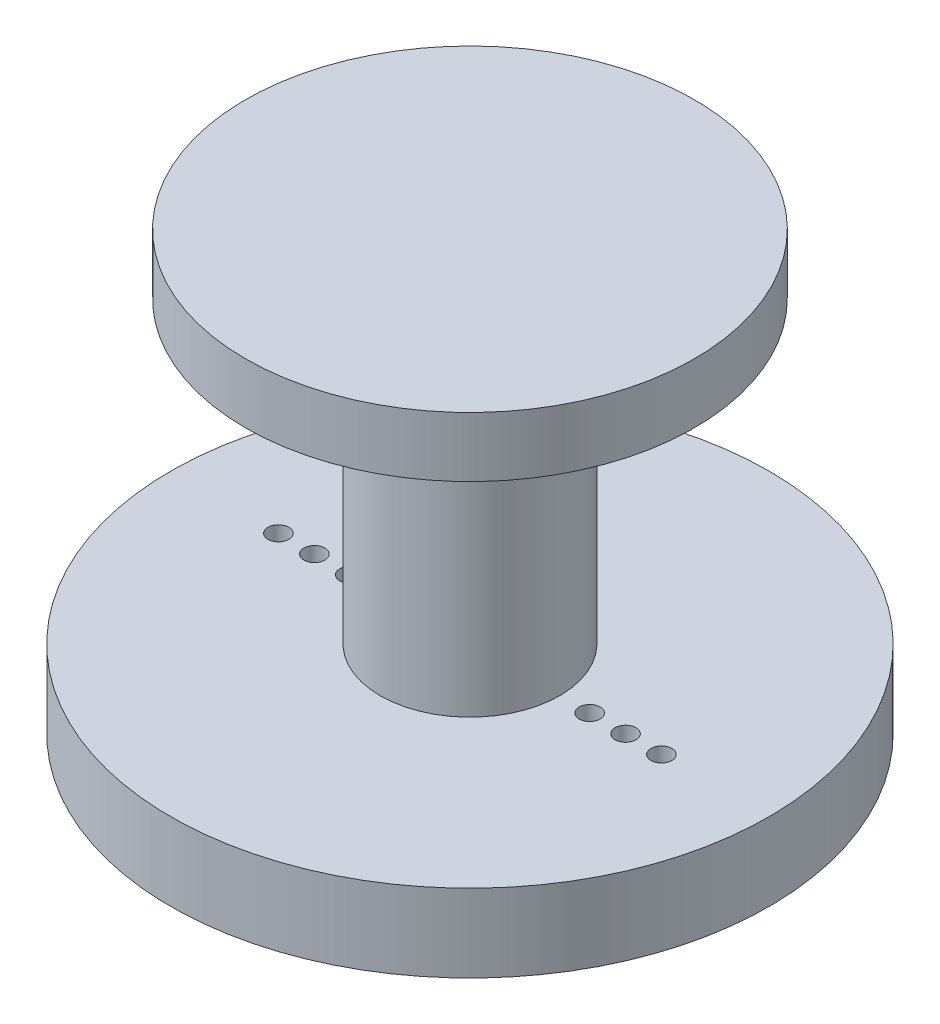
from build123d import *

# Parameters (mm, degrees)
SKETCH1_R             = 25
BOSS_EXTRUDE1_DEPTH   = 6.5
HORN_HOLE_DEPTH       = 2
SCREW_HOLES_REACH     = 37.641
SKETCH9_R             = 0.875
SKETCH11_R            = 7.5
BOSS_EXTRUDE2_DEPTH   = 25
SKETCH12_R            = 18.75
BOSS_EXTRUDE3_DEPTH   = 5
SCREW_HEAD_HOLE_ANGLE = 180


with BuildPart() as part:
    # Sketch1 → Boss-Extrude1 (new body)
    with BuildSketch(Plane(origin=(0, 0, 0), x_dir=(1, 0, 0), z_dir=(0, 1, 0))):
        Circle(SKETCH1_R)
    extrude(amount=BOSS_EXTRUDE1_DEPTH)

    # Sketch8 → Horn Hole (cut)
    with BuildSketch(Plane.XZ):
        with BuildLine():
            ThreePointArc((2.867832451, 6.276606431), (5.55485913, 5.311303559), (8.103473198, 4.024257195))
            ThreePointArc((8.103473198, 4.024257195), (12.790122891, 3.37163327), (17.445502266, 2.524257195))
            ThreePointArc((17.445502266, 2.524257195), (19.894779582, 1.820498395), (21, -0.475742805))
            ThreePointArc((21, -0.475742805), (19.60737188, -2.167378066), (17.445502266, -2.524257195))
            ThreePointArc((17.445502266, -2.524257195), (12.790122891, -3.37163327), (8.103473198, -4.024257195))
            ThreePointArc((8.103473198, -4.024257195), (5.55485913, -5.311303559), (2.867832451, -6.276606431))
            ThreePointArc((2.867832451, -6.276606431), (0, -6.900742805), (-2.867832451, -6.276606431))
            ThreePointArc((-2.867832451, -6.276606431), (-5.55485913, -5.311303559), (-8.103473198, -4.024257195))
            ThreePointArc((-8.103473198, -4.024257195), (-12.780142502, -3.846309279), (-17.445502266, -3.475742805))
            ThreePointArc((-17.445502266, -3.475742805), (-19.894779582, -2.771984005), (-21, -0.475742805))
            ThreePointArc((-21, -0.475742805), (-19.894779582, 1.820498395), (-17.445502266, 2.524257195))
            ThreePointArc((-17.445502266, 2.524257195), (-12.790122891, 3.37163327), (-8.103473198, 4.024257195))
            ThreePointArc((-8.103473198, 4.024257195), (-5.55485913, 5.311303559), (-2.867832451, 6.276606431))
            ThreePointArc((-2.867832451, 6.276606431), (0, 6.900742805), (2.867832451, 6.276606431))
        make_face()
    extrude(amount=-HORN_HOLE_DEPTH, mode=Mode.SUBTRACT)

    # Sketch9 → Screw Holes (cut, up to next)
    with BuildSketch(Plane.XZ.offset(-2), mode=Mode.PRIVATE) as screw_holes_sk1:
        with Locations((10, 0)):
            Circle(SKETCH9_R)
    screw_holes_tool1 = extrude(screw_holes_sk1.sketch, amount=-SCREW_HOLES_REACH, mode=Mode.PRIVATE) & part.part
    # Sketch9 → Screw Holes (cut, up to next)
    with BuildSketch(Plane.XZ.offset(-2), mode=Mode.PRIVATE) as screw_holes_sk2:
        with Locations((13, 0)):
            Circle(SKETCH9_R)
    screw_holes_tool2 = extrude(screw_holes_sk2.sketch, amount=-SCREW_HOLES_REACH, mode=Mode.PRIVATE) & part.part
    # Sketch9 → Screw Holes (cut, up to next)
    with BuildSketch(Plane.XZ.offset(-2), mode=Mode.PRIVATE) as screw_holes_sk3:
        with Locations((16, 0)):
            Circle(SKETCH9_R)
    screw_holes_tool3 = extrude(screw_holes_sk3.sketch, amount=-SCREW_HOLES_REACH, mode=Mode.PRIVATE) & part.part
    # Sketch9 → Screw Holes (cut, up to next)
    with BuildSketch(Plane.XZ.offset(-2), mode=Mode.PRIVATE) as screw_holes_sk4:
        with Locations((-10, 0)):
            Circle(SKETCH9_R)
    screw_holes_tool4 = extrude(screw_holes_sk4.sketch, amount=-SCREW_HOLES_REACH, mode=Mode.PRIVATE) & part.part
    # Sketch9 → Screw Holes (cut, up to next)
    with BuildSketch(Plane.XZ.offset(-2), mode=Mode.PRIVATE) as screw_holes_sk5:
        with Locations((-13, 0)):
            Circle(SKETCH9_R)
    screw_holes_tool5 = extrude(screw_holes_sk5.sketch, amount=-SCREW_HOLES_REACH, mode=Mode.PRIVATE) & part.part
    # Sketch9 → Screw Holes (cut, up to next)
    with BuildSketch(Plane.XZ.offset(-2), mode=Mode.PRIVATE) as screw_holes_sk6:
        with Locations((-16, 0)):
            Circle(SKETCH9_R)
    screw_holes_tool6 = extrude(screw_holes_sk6.sketch, amount=-SCREW_HOLES_REACH, mode=Mode.PRIVATE) & part.part
    add(screw_holes_tool1.solids().sort_by_distance((10, 2, 0))[0], mode=Mode.SUBTRACT)
    add(screw_holes_tool2.solids().sort_by_distance((13, 2, 0))[0], mode=Mode.SUBTRACT)
    add(screw_holes_tool3.solids().sort_by_distance((16, 2, 0))[0], mode=Mode.SUBTRACT)
    add(screw_holes_tool4.solids().sort_by_distance((-10, 2, 0))[0], mode=Mode.SUBTRACT)
    add(screw_holes_tool5.solids().sort_by_distance((-13, 2, 0))[0], mode=Mode.SUBTRACT)
    add(screw_holes_tool6.solids().sort_by_distance((-16, 2, 0))[0], mode=Mode.SUBTRACT)

    # Sketch11 → Boss-Extrude2 (add)
    with BuildSketch(Plane(origin=(0, 6.5, 0), x_dir=(1, 0, 0), z_dir=(0, 1, 0))):
        Circle(SKETCH11_R)
    extrude(amount=BOSS_EXTRUDE2_DEPTH)

    # Sketch12 → Boss-Extrude3 (add)
    with BuildSketch(Plane(origin=(0, 31.5, 0), x_dir=(1, 0, 0), z_dir=(0, 1, 0))):
        Circle(SKETCH12_R)
    extrude(amount=BOSS_EXTRUDE3_DEPTH)

    # Sketch13 → Screw Head Hole (revolve, cut)
    with BuildSketch(Plane.XZ.offset(-2)):
        with BuildLine():
            Line((3.4, 0), (-3.4, 0))
            ThreePointArc((-3.4, 0), (0, -3.4), (3.4, 0))
        make_face()
    revolve(axis=Axis((3.4, 2, 0), (1, 0, 0)), revolution_arc=SCREW_HEAD_HOLE_ANGLE, mode=Mode.SUBTRACT)


solid = part.part
